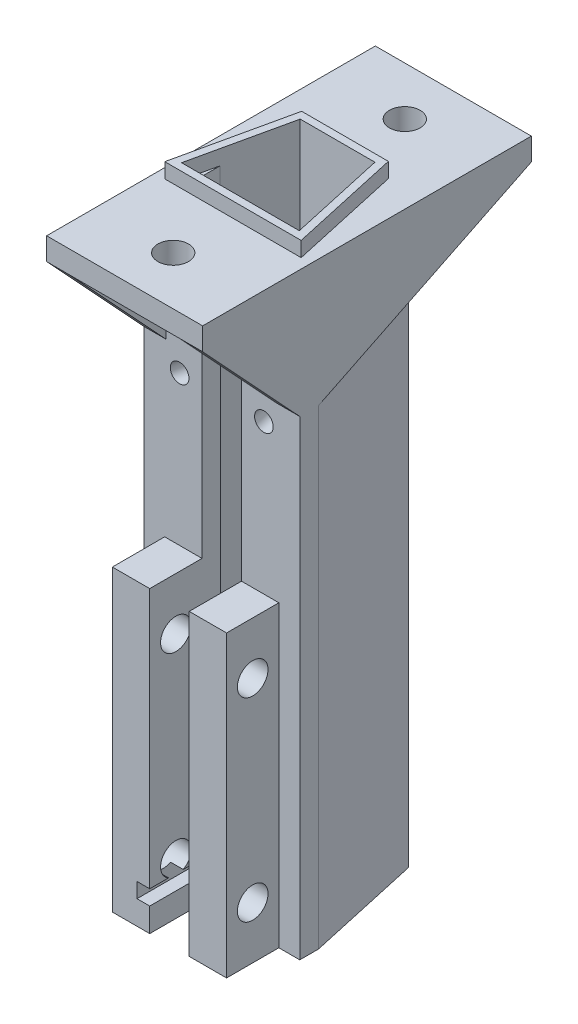
from build123d import *

# Parameters (mm, degrees)
BOSS_EXTRUDE1_DEPTH      = 40
SKETCH3_R                = 2.05
CUT_EXTRUDE2_DEPTH       = 40
BOSS_EXTRUDE2_DEPTH      = 40
SKETCH7_W                = 4.5
SKETCH7_H                = 2
CUT_EXTRUDE3_DEPTH       = 85.625305875
SKETCH8_W                = 1.7
SKETCH8_H                = 2
CUT_EXTRUDE4_DEPTH       = 83.320668087
BOSS_EXTRUDE3_DEPTH      = 2
SKETCH10_W               = 4.5
SKETCH10_H               = 75
CUT_EXTRUDE5_DEPTH       = 1.5
SKETCH13_W               = 2.8
SKETCH13_H               = 2
CUT_EXTRUDE7_DEPTH       = 1.5
SKETCH15_W               = 1.5
SKETCH15_H               = 2
CUT_EXTRUDE8_DEPTH       = 18.5
SKETCH16_R               = 1.25
CUT_EXTRUDE9_DEPTH       = 3.5
SKETCH17_R               = 1.25
CUT_EXTRUDE10_DEPTH      = 3.5
SKETCH18_W               = 20.8854588
SKETCH18_H               = 3
BOSS_EXTRUDE4_DEPTH      = 15.5
BOSS_EXTRUDE5_DEPTH      = 13
BOSS_EXTRUDE5_DEPTH_BACK = 2
SKETCH19_W               = 14.012924258
SKETCH19_H               = 3
BOSS_EXTRUDE6_DEPTH      = 3
BOSS_EXTRUDE8_DEPTH      = 3
BOSS_EXTRUDE9_DEPTH      = 3.5
BOSS_EXTRUDE10_DEPTH     = 3.5
SKETCH25_R               = 2.05
CUT_EXTRUDE12_DEPTH      = 3.5


with BuildPart() as part:
    # Sketch2 → Boss-Extrude1 (new body)
    with BuildSketch(Plane(origin=(0, 0, 0), x_dir=(1, 0, 0), z_dir=(0, 1, 0))):
        Polygon((5.768335638, 3.843580014), (-8.24458862, 3.843580014), (-11.680855891, -11.656419986), (-11.680855891, -14.156419986), (-8.880855891, -14.156419986), (-8.880855891, -21.156419986), (-3.880855891, -21.156419986), (-3.880855891, -11.656419986), (-9.120157106, -11.656419986), (-6.238126491, 1.343580014), (3.761873509, 1.343580014), (6.643904123, -11.656419986), (1.404602909, -11.656419986), (1.404602909, -21.156419986), (6.404602909, -21.156419986), (6.404602909, -14.156419986), (9.204602909, -14.156419986), (9.204602909, -11.656419986), align=None)
    extrude(amount=BOSS_EXTRUDE1_DEPTH)

    # Sketch3 → Cut-Extrude2 (cut)
    with BuildSketch(Plane.ZY.offset(8.880855891)):
        with Locations((17.656419986, 33)):
            Circle(SKETCH3_R)
        with Locations((17.656419986, 7)):
            Circle(SKETCH3_R)
    extrude(amount=-CUT_EXTRUDE2_DEPTH, mode=Mode.SUBTRACT)

    # Sketch4 → Boss-Extrude2 (add)
    with BuildSketch(Plane(origin=(0, 40, 0), x_dir=(1, 0, 0), z_dir=(0, 1, 0))):
        Polygon((-3.880855891, -11.656419986), (-9.120157106, -11.656419986), (-6.238126491, 1.343580014), (3.761873509, 1.343580014), (6.643904123, -11.656419986), (1.404602909, -11.656419986), (1.404602909, -14.156419986), (6.404602909, -14.156419986), (9.204602909, -14.156419986), (9.204602909, -11.656419986), (5.768335638, 3.843580014), (-8.24458862, 3.843580014), (-11.680855891, -11.656419986), (-11.680855891, -14.156419986), (-8.880855891, -14.156419986), (-3.880855891, -14.156419986), align=None)
    extrude(amount=BOSS_EXTRUDE2_DEPTH)

    # Sketch7 → Cut-Extrude3 (cut, through all)
    with BuildSketch(Plane(origin=(0, 0, -3.843580014), x_dir=(-1, 0, 0), z_dir=(0, 0, -1))):
        with Locations((3.241664362, 4.2)):
            Rectangle(SKETCH7_W, SKETCH7_H)
    extrude(amount=-CUT_EXTRUDE3_DEPTH, mode=Mode.SUBTRACT)

    # Sketch8 → Cut-Extrude4 (cut, through all)
    with BuildSketch(Plane(origin=(0, 0, 11.656419986), x_dir=(-1, 0, 0), z_dir=(0, 0, -1))):
        with Locations((4.730855891, 4.2)):
            Rectangle(SKETCH8_W, SKETCH8_H)
    extrude(amount=-CUT_EXTRUDE4_DEPTH, mode=Mode.SUBTRACT)

    # Sketch9 → Boss-Extrude3 (add)
    with BuildSketch(Plane(origin=(0, 80, 0), x_dir=(1, 0, 0), z_dir=(0, 1, 0))):
        Polygon((-10.366131283, -12.656419986), (7.8898783, -12.656419986), (4.56445836, 2.343580014), (-7.040711343, 2.343580014), align=None)
        Polygon((6.643904123, -11.656419986), (-9.120157106, -11.656419986), (-6.238126491, 1.343580014), (3.761873509, 1.343580014), align=None, mode=Mode.SUBTRACT)
    extrude(amount=BOSS_EXTRUDE3_DEPTH)

    # Sketch10 → Cut-Extrude5 (cut)
    with BuildSketch(Plane(origin=(0, 0, -3.843580014), x_dir=(-1, 0, 0), z_dir=(0, 0, -1))):
        with Locations((3.241664362, 42.7)):
            Rectangle(SKETCH10_W, SKETCH10_H)
    extrude(amount=-CUT_EXTRUDE5_DEPTH, mode=Mode.SUBTRACT)

    # Sketch13 → Cut-Extrude7 (cut)
    with BuildSketch(Plane(origin=(0, 0, -2.343580014), x_dir=(-1, 0, 0), z_dir=(0, 0, -1))):
        with Locations((6.891664362, 6.2)):
            Rectangle(SKETCH13_W, SKETCH13_H)
    extrude(amount=CUT_EXTRUDE7_DEPTH, mode=Mode.SUBTRACT)

    # Sketch15 → Cut-Extrude8 (cut, along a direction that is not the sketch's normal)
    with BuildSketch(Plane(origin=(0, 0, -3.843580014), x_dir=(-1, 0, 0), z_dir=(0, 0, -1))):
        with Locations((7.49458862, 6.2)):
            Rectangle(SKETCH15_W, SKETCH15_H)
    extrude(amount=-CUT_EXTRUDE8_DEPTH, dir=(0.21643961393810404, 0, -0.976296007119933), mode=Mode.SUBTRACT)

    # Sketch16 → Cut-Extrude9 (cut, along a direction that is not the sketch's normal)
    with BuildSketch(Plane.XY.offset(14.156419986)):
        with Locations((-6.880855891, 60)):
            Circle(SKETCH16_R)
    extrude(amount=-CUT_EXTRUDE9_DEPTH, dir=(-0.21643961393810382, 0, 0.9762960071199333), mode=Mode.SUBTRACT)

    # Sketch17 → Cut-Extrude10 (cut, along a direction that is not the sketch's normal)
    with BuildSketch(Plane.XY.offset(14.156419986)):
        with Locations((4.404602909, 60)):
            Circle(SKETCH17_R)
    extrude(amount=-CUT_EXTRUDE10_DEPTH, dir=(0.21643961393810268, 0, 0.9762960071199334), mode=Mode.SUBTRACT)

    # Sketch18 → Boss-Extrude4 (add)
    with BuildSketch(Plane(origin=(0, 0, 11.656419986), x_dir=(-1, 0, 0), z_dir=(0, 0, -1))):
        with Locations((1.238126491, 78.5)):
            Rectangle(SKETCH18_W, SKETCH18_H)
    extrude(amount=-BOSS_EXTRUDE4_DEPTH)

    # Sketch19 → Boss-Extrude5 (add, two sides: drawn at the far end of the back side and taken through both)
    with BuildSketch(Plane(origin=(0, 0, -3.843580014), x_dir=(-1, 0, 0), z_dir=(0, 0, -1)).offset(-BOSS_EXTRUDE5_DEPTH_BACK)):
        with Locations((1.238126491, 78.5)):
            Rectangle(SKETCH19_W, SKETCH19_H)
    extrude(amount=BOSS_EXTRUDE5_DEPTH + BOSS_EXTRUDE5_DEPTH_BACK)

    # Sketch21 → Boss-Extrude6 (add)
    with BuildSketch(Plane.ZY.offset(11.680855891)):
        Polygon((27.156419986, 77), (14.156419986, 63), (14.156419986, 77), align=None)
    extrude(amount=-BOSS_EXTRUDE6_DEPTH)

    # Sketch22 → Boss-Extrude8 (add)
    with BuildSketch(Plane(origin=(9.204602909, 0, 0), x_dir=(0, 0, -1), z_dir=(1, 0, 0))):
        Polygon((-27.156419986, 77), (-14.156419986, 77), (-14.156419986, 63), align=None)
    extrude(amount=-BOSS_EXTRUDE8_DEPTH)

    # Sketch23 → Boss-Extrude9 (add)
    with BuildSketch(Plane(origin=(9.204602909, 0, 0), x_dir=(0, 0, -1), z_dir=(1, 0, 0))):
        Polygon((-11.656419986, 80), (-11.656419986, 63), (16.843580014, 77), (16.843580014, 80), align=None)
    extrude(amount=-BOSS_EXTRUDE9_DEPTH)

    # Sketch24 → Boss-Extrude10 (add)
    with BuildSketch(Plane.ZY.offset(11.680855891)):
        Polygon((11.656419986, 80), (-16.843580014, 80), (-16.843580014, 77), (11.656419986, 63), align=None)
    extrude(amount=-BOSS_EXTRUDE10_DEPTH)

    # Sketch25 → Cut-Extrude12 (cut)
    with BuildSketch(Plane(origin=(0, 80, 0), x_dir=(1, 0, 0), z_dir=(0, 1, 0))):
        with Locations((-1.23812564, 10.343580014)):
            Circle(SKETCH25_R)
        with Locations((-1.2381217, -20.656419986)):
            Circle(SKETCH25_R)
    extrude(amount=-CUT_EXTRUDE12_DEPTH, mode=Mode.SUBTRACT)


solid = part.part
